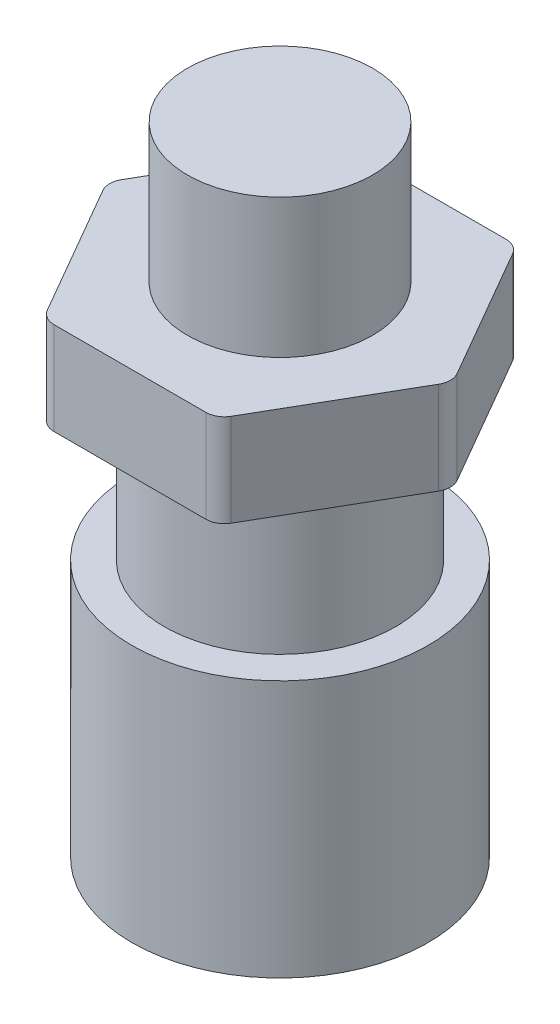
from build123d import *

# Parameters (mm, degrees)
BOSS_EXTRUDE1_DEPTH = 12.7
FILLET1_R           = 2.54
SKETCH2_R           = 20.32
BOSS_EXTRUDE4_DEPTH = 55.626
SKETCH4_R           = 20.32
SKETCH4_R_2         = 15.875
CUT_EXTRUDE1_DEPTH  = 20.32
SKETCH5_R           = 12.7
BOSS_EXTRUDE5_DEPTH = 19.05


with BuildPart() as part:
    # Sketch1 → Boss-Extrude1 (new body)
    with BuildSketch(Plane(origin=(0, 0, 0), x_dir=(1, 0, 0), z_dir=(0, 1, 0))):
        Polygon((-11.878404438, 20.574), (11.878404438, 20.574), (23.756808877, 0), (11.878404438, -20.574), (-11.878404438, -20.574), (-23.756808877, 0), align=None)
    extrude(amount=BOSS_EXTRUDE1_DEPTH)

    # Fillet1
    fillet1_edges = [part.edges().sort_by_distance(p)[0] for p in [
        (-11.878404438, 6.35, 20.574),
        (-23.756808877, 6.35, 0),
        (-11.878404438, 6.35, -20.574),
        (11.878404438, 6.35, -20.574),
        (11.878404438, 6.35, 20.574),
        (23.756808877, 6.35, 0),
    ]]
    fillet(fillet1_edges, radius=FILLET1_R)

    # Sketch2 → Boss-Extrude4 (add)
    with BuildSketch(Plane.XZ):
        Circle(SKETCH2_R)
    extrude(amount=BOSS_EXTRUDE4_DEPTH)

    # Sketch4 → Cut-Extrude1 (cut)
    with BuildSketch(Plane.XZ):
        Circle(SKETCH4_R)
        Circle(SKETCH4_R_2, mode=Mode.SUBTRACT)
    extrude(amount=CUT_EXTRUDE1_DEPTH, mode=Mode.SUBTRACT)

    # Sketch5 → Boss-Extrude5 (add)
    with BuildSketch(Plane(origin=(0, 12.7, 0), x_dir=(1, 0, 0), z_dir=(0, 1, 0))):
        Circle(SKETCH5_R)
    extrude(amount=BOSS_EXTRUDE5_DEPTH)


solid = part.part
